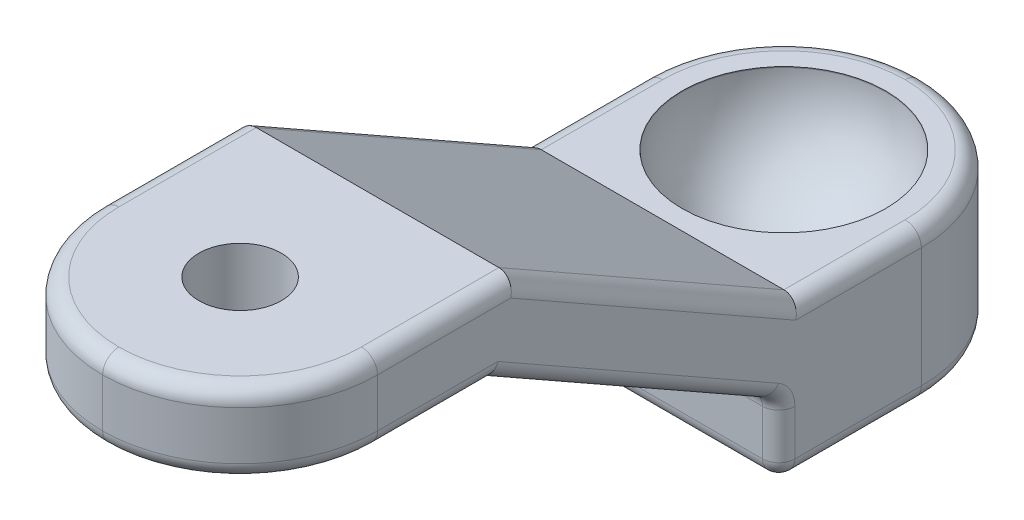
from build123d import *

# Parameters (mm, degrees)
PROFILEEXTRUDE_THIN1_DEPTH          = 34
DOMEPADEXTENSIONSKETCH1_W           = 34
DOMEPADEXTENSIONSKETCH1_H           = 34.639067238
DOMEPADEXTENSIONBOSS_EXTRUDE1_DEPTH = 8.8
FILLET1_R                           = 17
FILLET2_R                           = 17
FLANGENUTHOLESKETCH4_R              = 5.1
FLANGENUTHOLECUT_EXTRUDE5_DEPTH     = 114.638162666
DOMEINDENTSKETCH6_R                 = 12.6
DOMEINDENTCUT_EXTRUDE8_DEPTH        = 0.1
DOME2_FACE_RADIUS                   = 12.6
DOME2_HEIGHT                        = 12.5
FILLET3_R                           = 17
FILLET4_R                           = 17
BOTTOMBOUNDARYFILLET5_R             = 2
FLANGENUTHOLESSKETCH2_R             = 2
FLANGENUTHOLESCUT_EXTRUDE1_DEPTH    = 4
FILLET6_R                           = 2


with BuildPart() as part:
    # ProfileSketch1 → ProfileExtrude-Thin1 (new body)
    with BuildSketch(Plane(origin=(0, 0, 0), x_dir=(0, 0, -1), z_dir=(1, 0, 0))):
        Polygon((0, 0), (34, 0), (69.253108664, -20), (101.253108664, -20), (101.253108664, -30), (66.614041426, -30), (31.360932762, -10), (0, -10), align=None)
    extrude(amount=PROFILEEXTRUDE_THIN1_DEPTH)

    # DomePadExtensionSketch1 → DomePadExtensionBoss-Extrude1 (add)
    with BuildSketch(Plane.XZ.offset(30)):
        with Locations((17, -83.933575045)):
            Rectangle(DOMEPADEXTENSIONSKETCH1_W, DOMEPADEXTENSIONSKETCH1_H)
    extrude(amount=DOMEPADEXTENSIONBOSS_EXTRUDE1_DEPTH)

    # Fillet1
    fillet1_edges = [part.edges().sort_by_distance(p)[0] for p in [
        (34, -5, 0),
    ]]
    fillet(fillet1_edges, radius=FILLET1_R)

    # Fillet2
    fillet2_edges = [part.edges().sort_by_distance(p)[0] for p in [
        (0, -5, 0),
    ]]
    fillet(fillet2_edges, radius=FILLET2_R - 0.0001)  # a hair under: the kernel refuses the full size

    # FlangeNutHoleSketch4 → FlangeNutHoleCut-Extrude5 (cut, through all)
    with BuildSketch(Plane(origin=(0, 0, 0), x_dir=(1, 0, 0), z_dir=(0, 1, 0))):
        with Locations(Location((17, 17, 0), (0, 0, 270))):
            Circle(FLANGENUTHOLESKETCH4_R)
    extrude(amount=-FLANGENUTHOLECUT_EXTRUDE5_DEPTH, mode=Mode.SUBTRACT)

    # DomeIndentSketch6 → DomeIndentCut-Extrude8 (cut)
    with BuildSketch(Plane(origin=(0, -20, 0), x_dir=(1, 0, 0), z_dir=(0, 1, 0))):
        with Locations(Location((17, 84.253108664, 0), (0, 0, 270))):
            Circle(DOMEINDENTSKETCH6_R)
    extrude(amount=-DOMEINDENTCUT_EXTRUDE8_DEPTH, mode=Mode.SUBTRACT)

    # Dome2: a dome of height H over a round flat face of radius A is a cap of a sphere of radius (A * A + H * H) / (2 * H)
    dome2_r = (DOME2_FACE_RADIUS * DOME2_FACE_RADIUS + DOME2_HEIGHT * DOME2_HEIGHT) / (2 * DOME2_HEIGHT)
    dome2_base = Plane((17, -20.1, -84.253108664), z_dir=(0, -1, 0))
    with Locations(dome2_base.offset(DOME2_HEIGHT - dome2_r)):
        dome2_ball = Sphere(dome2_r, mode=Mode.PRIVATE)
    add(split(dome2_ball, bisect_by=dome2_base, keep=Keep.TOP, mode=Mode.PRIVATE), mode=Mode.SUBTRACT)

    # Fillet3
    fillet3_edges = [part.edges().sort_by_distance(p)[0] for p in [
        (34, -29.4, -101.253108664),
    ]]
    fillet(fillet3_edges, radius=FILLET3_R)

    # Fillet4
    fillet4_edges = [part.edges().sort_by_distance(p)[0] for p in [
        (0, -29.4, -101.253108664),
    ]]
    fillet(fillet4_edges, radius=FILLET4_R - 0.0001)  # a hair under: the kernel refuses the full size

    # BottomBoundaryFillet5
    bottomboundaryfillet5_edges = [part.edges().sort_by_distance(p)[0] for p in [
        (17, -30, -66.614041426),
        (0, -34.4, -66.614041426),
        (34, -34.4, -66.614041426),
        (0, -38.8, -75.433625045),
        (17, -38.8, -66.614041426),
        (34, -20, -48.987487094),
        (34, -10, -24.180466381),
        (29.02081528, -10, -4.97918472),
        (0, -10, -24.180416381),
        (4.979155431, -10, -4.979155431),
        (34, -38.8, -75.433575045),
        (29.02081528, -38.8, -96.273923944),
        (4.979155431, -38.8, -96.273953234),
        (0, -20, -48.987487094),
    ]]
    fillet(bottomboundaryfillet5_edges, radius=BOTTOMBOUNDARYFILLET5_R)

    # FlangeNutHolesSketch2 → FlangeNutHolesCut-Extrude1 (cut)
    with BuildSketch(Plane.XZ.offset(10)):
        with Locations(Location((11.343145751, -11.343145751, 0), (0, 0, 270))):
            Circle(FLANGENUTHOLESSKETCH2_R)
        with Locations(Location((22.656854249, -11.343145751, 0), (0, 0, 270))):
            Circle(FLANGENUTHOLESSKETCH2_R)
        with Locations(Location((22.656854249, -22.656854249, 0), (0, 0, 270))):
            Circle(FLANGENUTHOLESSKETCH2_R)
        with Locations(Location((11.343145751, -22.656854249, 0), (0, 0, 270))):
            Circle(FLANGENUTHOLESSKETCH2_R)
    extrude(amount=-FLANGENUTHOLESCUT_EXTRUDE1_DEPTH, mode=Mode.SUBTRACT)

    # Fillet6
    fillet6_edges = [part.edges().sort_by_distance(p)[0] for p in [
        (34, -20, -76.753108664),
        (34, -10, -51.626554332),
        (34, 0, -25.5),
        (29.02081528, 0, -4.97918472),
        (0, 0, -25.49995),
        (4.979155431, 0, -4.979155431),
        (29.02081528, -20, -96.273923944),
        (4.979155431, -20, -96.273953234),
        (0, -10, -51.626554332),
        (0, -20, -76.753158664),
    ]]
    fillet(fillet6_edges, radius=FILLET6_R)


solid = part.part
